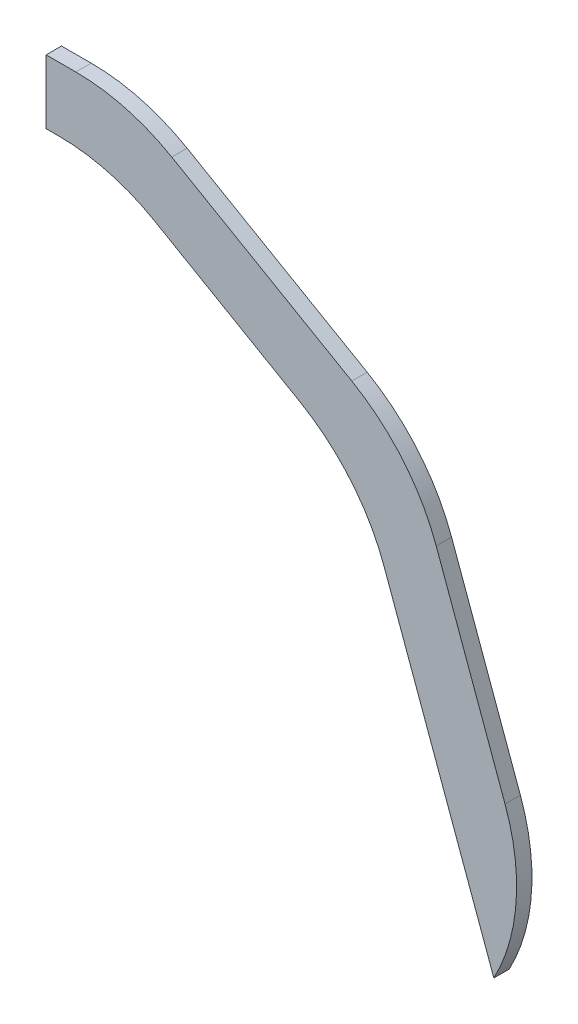
from build123d import *

# Parameters (mm, degrees)
BOSS_EXTRUDE1_DEPTH = 0.12
FILLET1_R           = 3


with BuildPart() as part:
    # Sketch1 → Boss-Extrude1 (new, symmetric)
    with BuildSketch(Plane.XY):
        Polygon((0, 0), (1, 0), (4.909846718, -2.257351055), (7, -8), (7.652703645, -6.869484125), (5.725054187, -1.573310769), (1.267949192, 1), (0, 1), align=None)
    extrude(amount=BOSS_EXTRUDE1_DEPTH, both=True)

    # Fillet1
    # the kernel refuses this fillet: 3 mm, written as the material it adds along each edge
    with BuildSketch(Plane(origin=(1, 0, -0.12), x_dir=(-1, 0, 0), z_dir=(0, 0, 1))) as fillet1_piece_1:
        with BuildLine():
            CenterArc((FILLET1_R * 0.267949192431, FILLET1_R), FILLET1_R, 240, 30)
            Line((-FILLET1_R * 0.232050807569, FILLET1_R * 0.133974596216), (-FILLET1_R * 0.242050807569, FILLET1_R * 0.11665408814))
            Line((-FILLET1_R * 0.242050807569, FILLET1_R * 0.11665408814), (-FILLET1_R * 0.00535898384862, -FILLET1_R * 0.02))
            Line((-FILLET1_R * 0.00535898384862, -FILLET1_R * 0.02), (FILLET1_R * 0.267949192431, -FILLET1_R * 0.02))
            Line((FILLET1_R * 0.267949192431, -FILLET1_R * 0.02), (FILLET1_R * 0.267949192431, 0))
        make_face()
    extrude(amount=0.24)
    # the kernel refuses this fillet: 3 mm, written as the material it adds along each edge
    with BuildSketch(Plane(origin=(4.909846718, -2.257351055, -0.12), x_dir=(0.34202014332566544, -0.9396926207859095, 0), z_dir=(0, 0, 1))) as fillet1_2_piece_1:
        with BuildLine():
            CenterArc((FILLET1_R * 0.363970234266, -FILLET1_R), FILLET1_R, 90, 40)
            Line((-FILLET1_R * 0.27881737542, -FILLET1_R * 0.233955556881), (-FILLET1_R * 0.291673127614, -FILLET1_R * 0.218634668019))
            Line((-FILLET1_R * 0.291673127614, -FILLET1_R * 0.218634668019), (-FILLET1_R * 0.00727940468532, FILLET1_R * 0.02))
            Line((-FILLET1_R * 0.00727940468532, FILLET1_R * 0.02), (FILLET1_R * 0.363970234266, FILLET1_R * 0.02))
            Line((FILLET1_R * 0.363970234266, FILLET1_R * 0.02), (FILLET1_R * 0.363970234266, 0))
        make_face()
    extrude(amount=0.24)
    # the kernel refuses this fillet: 3 mm, written as the material it takes off along each edge
    with BuildSketch(Plane(origin=(1.267949192, 1, 2.129618943), x_dir=(-1, 0, 0), z_dir=(0, 0, -1))) as fillet1_3_piece_1:
        with BuildLine():
            CenterArc((FILLET1_R * 0.267949192431, -FILLET1_R), FILLET1_R, 90, 30)
            Line((-FILLET1_R * 0.232050807569, -FILLET1_R * 0.133974596216), (-FILLET1_R * 0.242050807569, -FILLET1_R * 0.11665408814))
            Line((-FILLET1_R * 0.242050807569, -FILLET1_R * 0.11665408814), (-FILLET1_R * 0.00535898384862, FILLET1_R * 0.02))
            Line((-FILLET1_R * 0.00535898384862, FILLET1_R * 0.02), (FILLET1_R * 0.267949192431, FILLET1_R * 0.02))
            Line((FILLET1_R * 0.267949192431, FILLET1_R * 0.02), (FILLET1_R * 0.267949192431, 0))
        make_face()
    extrude(amount=4.259237886, mode=Mode.SUBTRACT)
    # the kernel refuses this fillet: 3 mm, written as the material it takes off along each edge
    with BuildSketch(Plane(origin=(5.725054187, -1.573310769, -2.849776757), x_dir=(-0.8660254037844383, 0.5000000000000006, 0), z_dir=(0, 0, 1))) as fillet1_4_piece_1:
        with BuildLine():
            CenterArc((FILLET1_R * 0.363970234266, FILLET1_R), FILLET1_R, 230, 40)
            Line((-FILLET1_R * 0.27881737542, FILLET1_R * 0.233955556881), (-FILLET1_R * 0.291673127614, FILLET1_R * 0.218634668019))
            Line((-FILLET1_R * 0.291673127614, FILLET1_R * 0.218634668019), (-FILLET1_R * 0.00727940468532, -FILLET1_R * 0.02))
            Line((-FILLET1_R * 0.00727940468532, -FILLET1_R * 0.02), (FILLET1_R * 0.363970234266, -FILLET1_R * 0.02))
            Line((FILLET1_R * 0.363970234266, -FILLET1_R * 0.02), (FILLET1_R * 0.363970234266, 0))
        make_face()
    extrude(amount=5.699553514, mode=Mode.SUBTRACT)
    # the kernel refuses this fillet: 3 mm, written as the material it takes off along each edge
    with BuildSketch(Plane(origin=(7.652703645, -6.869484125, -3.612420866), x_dir=(-0.34202014332566655, 0.9396926207859092, 0), z_dir=(0, 0, 1))) as fillet1_5_piece_1:
        with BuildLine():
            CenterArc((1.396968346, 3), FILLET1_R, 221.810314896, 48.189685104)
            Line((-0.839099631, 1), (-0.883820991, 0.96))
            ThreePointArc((-0.883820991, 0.96), (-0.465512482, 0.461432743), (-0.045962667, -0.038567257))
            Line((-0.045962667, -0.038567257), (0, -0.06))
            Line((0, -0.06), (1.396968346, -0.06))
            Line((1.396968346, -0.06), (1.396968346, 0))
        make_face()
    extrude(amount=7.224841732, mode=Mode.SUBTRACT)


solid = part.part
